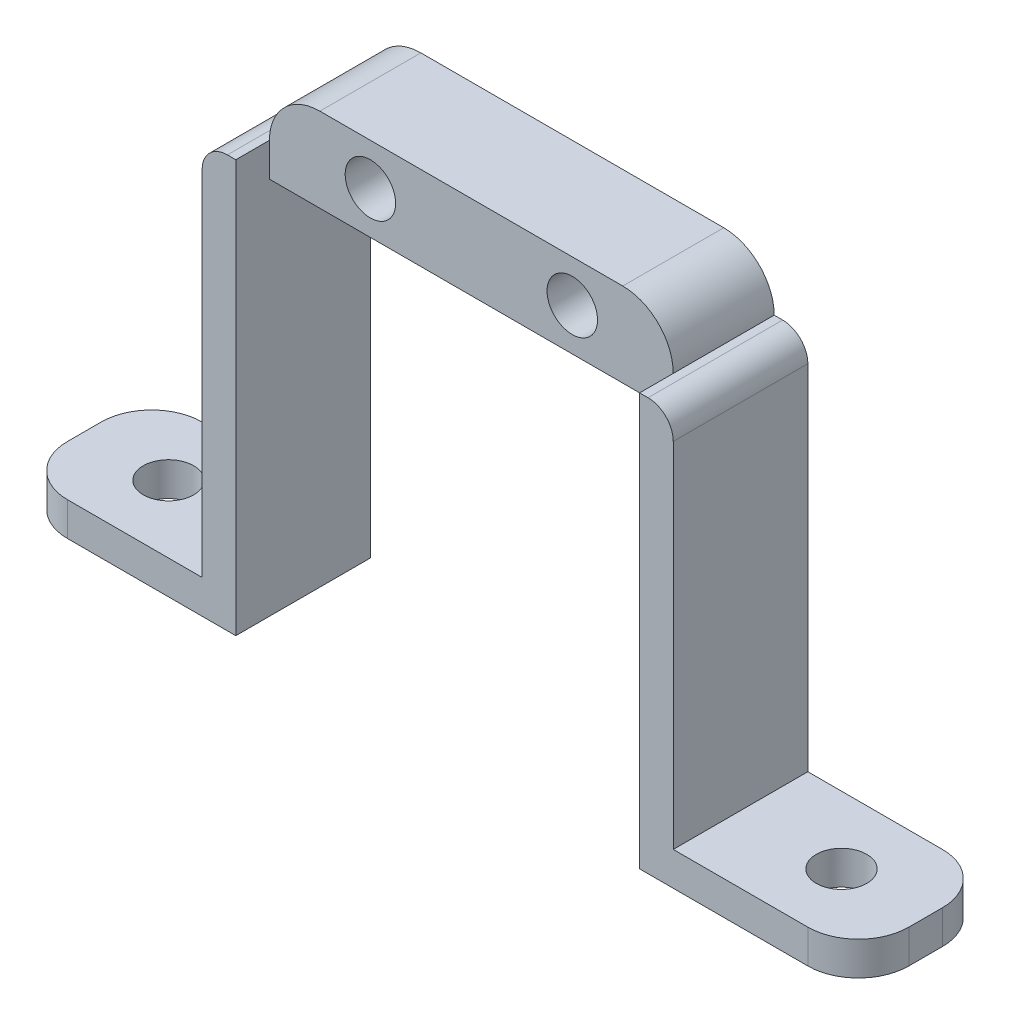
from build123d import *

# Parameters (mm, degrees)
EXTRUIR_L_MINA1_DEPTH   = 8
CROQUIS2_W              = 24
CROQUIS2_H              = 2
CORTAR_EXTRUIR1_DEPTH   = 2
CROQUIS3_W              = 24
CROQUIS3_H              = 6
SALIENTE_EXTRUIR1_DEPTH = 3
CROQUIS4_R              = 1.5
CORTAR_EXTRUIR2_DEPTH   = 58.621610529
CROQUIS5_R              = 1.5
CORTAR_EXTRUIR3_DEPTH   = 58.621610529
REDONDEO1_R             = 3
REDONDEO2_R             = 1.5


with BuildPart() as part:
    # Croquis1 → Extruir-Lámina1 (new body)
    with BuildSketch(Plane.XY):
        Polygon((0, 0), (13, 0), (13, 22.5), (37, 22.5), (37, 0), (50, 0), (50, 2), (39, 2), (39, 24.5), (11, 24.5), (11, 2), (0, 2), align=None)
    extrude(amount=EXTRUIR_L_MINA1_DEPTH)

    # Croquis2 → Cortar-Extruir1 (cut)
    with BuildSketch(Plane.XY.offset(8)):
        with Locations((25, 23.5)):
            Rectangle(CROQUIS2_W, CROQUIS2_H)
    extrude(amount=-CORTAR_EXTRUIR1_DEPTH, mode=Mode.SUBTRACT)

    # Croquis3 → Saliente-Extruir1 (add)
    with BuildSketch(Plane(origin=(0, 24.5, 0), x_dir=(1, 0, 0), z_dir=(0, 1, 0))):
        with Locations((25, -3)):
            Rectangle(CROQUIS3_W, CROQUIS3_H)
    extrude(amount=SALIENTE_EXTRUIR1_DEPTH)

    # Croquis4 → Cortar-Extruir2 (cut, through all)
    with BuildSketch(Plane(origin=(0, 0, 0), x_dir=(-1, 0, 0), z_dir=(0, 0, -1))):
        with Locations((-19, 25)):
            Circle(CROQUIS4_R)
        with Locations((-31, 25)):
            Circle(CROQUIS4_R)
    extrude(amount=-CORTAR_EXTRUIR2_DEPTH, mode=Mode.SUBTRACT)

    # Croquis5 → Cortar-Extruir3 (cut, through all)
    with BuildSketch(Plane.XZ):
        with Locations(Location((45, 4, 0), (0, 0, 270))):
            Circle(CROQUIS5_R)
        with Locations(Location((5, 4, 0), (0, 0, 90))):
            Circle(CROQUIS5_R)
    extrude(amount=-CORTAR_EXTRUIR3_DEPTH, mode=Mode.SUBTRACT)

    # Redondeo1
    redondeo1_edges = [part.edges().sort_by_distance(p)[0] for p in [
        (13, 27.5, 3),
        (37, 27.5, 3),
        (50, 1, 8),
        (50, 1, 0),
        (0, 1, 0),
        (0, 1, 8),
    ]]
    fillet(redondeo1_edges, radius=REDONDEO1_R - 0.0001)  # a hair under: the kernel refuses the full size

    # Redondeo2
    redondeo2_edges = [part.edges().sort_by_distance(p)[0] for p in [
        (11, 24.5, 4),
        (39, 24.5, 4),
    ]]
    fillet(redondeo2_edges, radius=REDONDEO2_R)


solid = part.part
